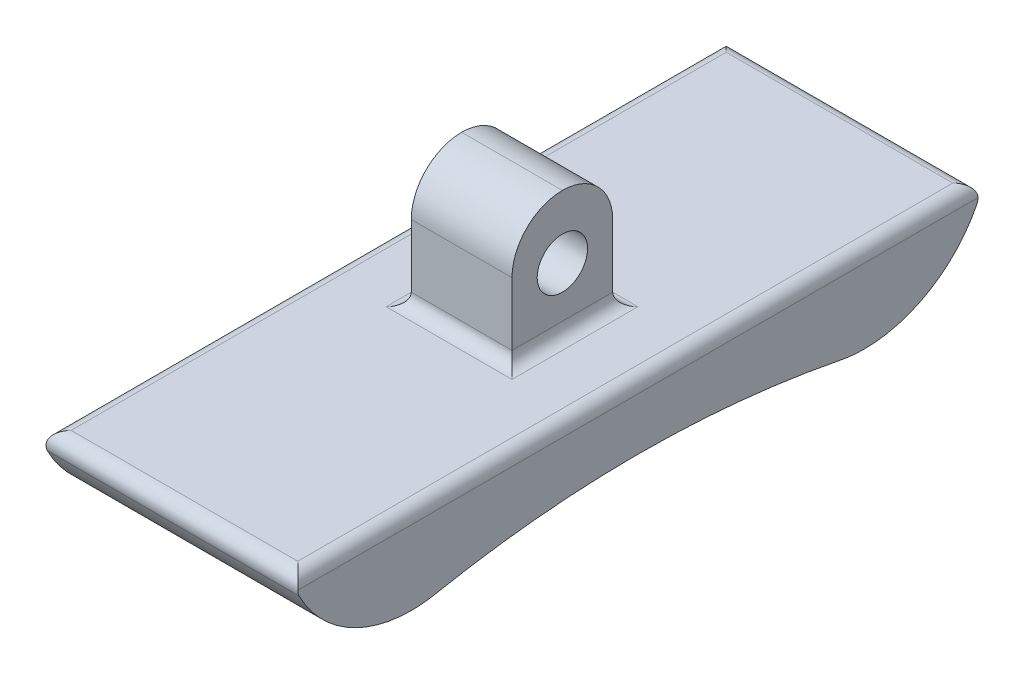
from build123d import *

# Parameters (mm, degrees)
SALIENTE_EXTRUIR1_DEPTH    = 10
CROQUIS2_OUTSIDE_W         = 34.364
CROQUIS2_OUTSIDE_H         = 70.364
CROQUIS2_OUTSIDE_W_2       = 8
CROQUIS2_OUTSIDE_H_2       = 8
CORTAR_EXTRUIR2_DEPTH      = 10
CROQUIS3_R                 = 2
CORTAR_EXTRUIR3_DEPTH      = 33.445689749
CORTAR_EXTRUIR4_DEPTH      = 31.9309357
CORTAR_EXTRUIR4_DEPTH_BACK = 31.9309357
CROQUIS6_R                 = 50
REDONDEO1_R                = 1
REDONDEO3_R                = 4


with BuildPart() as part:
    # Croquis1 → Saliente-Extruir1 (new, symmetric)
    with BuildSketch(Plane(origin=(0, 0, 0), x_dir=(0, 0, -1), z_dir=(1, 0, 0))):
        with BuildLine():
            Line((-28, 10), (28, 10))
            Line((28, 10), (28, 3.096227789))
            ThreePointArc((28, 3.096227789), (24.352048797, -4.627209016), (16.069704783, -6.715701704))
            ThreePointArc((16.069704783, -6.715701704), (0, -5.150015015), (-16.069704783, -6.715701704))
            ThreePointArc((-16.069704783, -6.715701704), (-24.352048797, -4.627209016), (-28, 3.096227789))
            Line((-28, 3.096227789), (-28, 10))
        make_face()
    extrude(amount=SALIENTE_EXTRUIR1_DEPTH, both=True)

    # Croquis2 outside → Cortar-Extruir2 (cut)
    with BuildSketch(Plane(origin=(0, 10, 0), x_dir=(1, 0, 0), z_dir=(0, 1, 0))):
        Rectangle(CROQUIS2_OUTSIDE_W, CROQUIS2_OUTSIDE_H)
        Rectangle(CROQUIS2_OUTSIDE_W_2, CROQUIS2_OUTSIDE_H_2, mode=Mode.SUBTRACT)
    extrude(amount=-CORTAR_EXTRUIR2_DEPTH, mode=Mode.SUBTRACT)

    # Croquis3 → Cortar-Extruir3 (cut, through all)
    with BuildSketch(Plane.ZY.offset(4)):
        with Locations((0, 5)):
            Circle(CROQUIS3_R)
    extrude(amount=-CORTAR_EXTRUIR3_DEPTH, mode=Mode.SUBTRACT)

    # Croquis6 → Cortar-Extruir4 (cut, two sides: drawn at the far end of the back side and taken through both)
    with BuildSketch(Plane.XY.offset(-CORTAR_EXTRUIR4_DEPTH_BACK)):
        with Locations((0, -55.893567066)):
            Circle(CROQUIS6_R)
    extrude(amount=CORTAR_EXTRUIR4_DEPTH + CORTAR_EXTRUIR4_DEPTH_BACK, mode=Mode.SUBTRACT)

    # Redondeo1
    redondeo1_edges = [part.edges().sort_by_distance(p)[0] for p in [
        (-10, 0, 0),
        (0, 0, -27.508594716),
        (0, 0, 27.508594716),
        (10, 0, 0),
        (0, 0, -4),
        (-4, 0, 0),
        (0, 0, 4),
        (4, 0, 0),
    ]]
    fillet(redondeo1_edges, radius=REDONDEO1_R)

    # Redondeo3
    redondeo3_edges = [part.edges().sort_by_distance(p)[0] for p in [
        (0, 10, -4),
        (0, 10, 4),
    ]]
    fillet(redondeo3_edges, radius=REDONDEO3_R - 0.0001)  # a hair under: the kernel refuses the full size


solid = part.part
